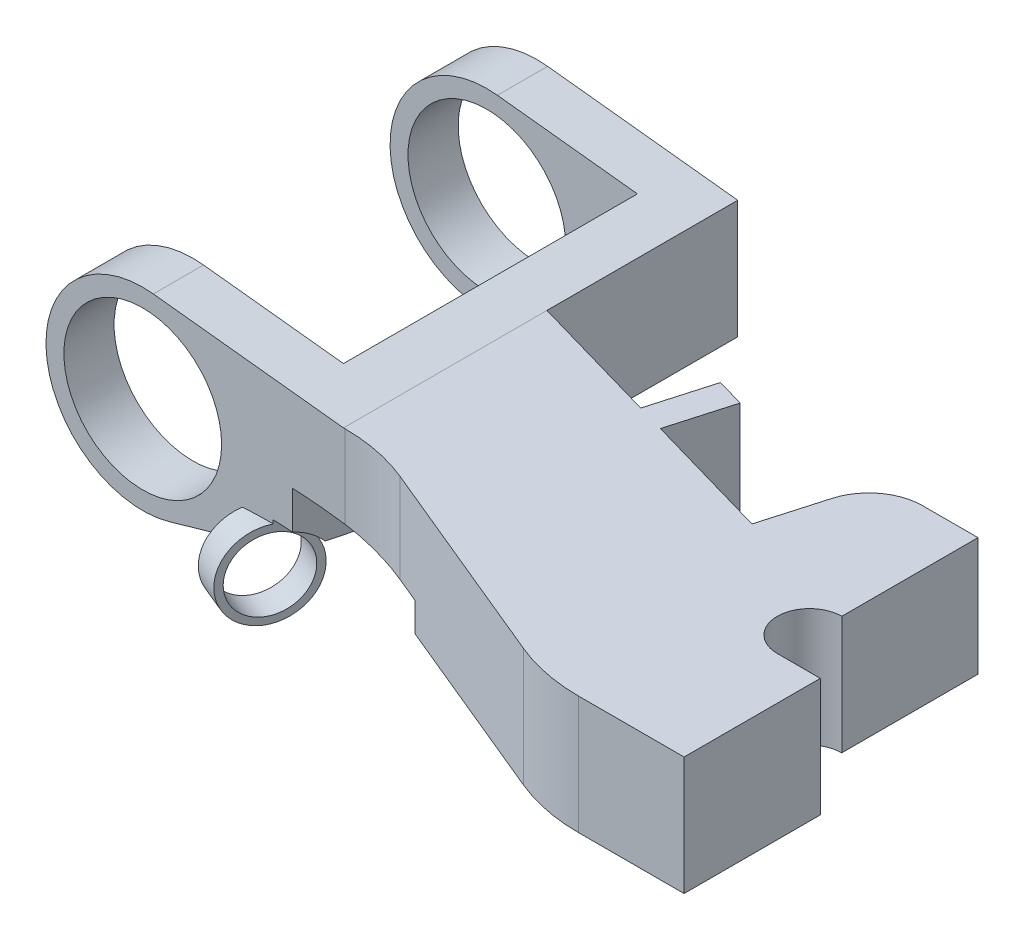
from build123d import *

# Parameters (mm, degrees)
EXTRUDE_1_DEPTH          = 13.5
CUT_EXTRUDE_1_DEPTH      = 136.073128342
CUT_EXTRUDE_1_DEPTH_BACK = 136.073128342
SKETCH_11_R              = 11
SKETCH_12_R              = 2.5
EXTRUDE_2_DEPTH          = 4.5
SKETCH_13_R              = 2.5
EXTRUDE_3_DEPTH          = 4.5
FILLET_1_R               = 25
SKETCH_15_R              = 6
SKETCH_15_R_2            = 5
EXTRUDE_4_DEPTH          = 4
CUT_EXTRUDE_START        = -4
SKETCH_19_R              = 5
CUT_EXTRUDE_3_DEPTH      = 4
CUT_EXTRUDE_START_2      = -0.5
SKETCH_20_R              = 5
CUT_EXTRUDE_4_DEPTH      = 0.5


with BuildPart() as part:
    # Эскиз10 → Бобышка-Вытянуть1 (new, symmetric)
    with BuildSketch(Plane(origin=(0, 0, 0), x_dir=(1, 0, 0), z_dir=(0, 1, 0))):
        with BuildLine():
            Line((-78, 61.5), (-92.5, 61.5))
            Line((-92.5, 61.5), (-119.5, 61.5))
            Line((-119.5, 61.5), (-119.5, 54.5))
            Line((-119.5, 54.5), (-92.5, 54.5))
            Line((-92.5, 54.5), (-85, 54.5))
            Line((-85, 54.5), (-85, 13.5))
            Line((-85, 13.5), (-92.5, 13.5))
            Line((-92.5, 13.5), (-119.5, 13.5))
            Line((-119.5, 13.5), (-119.5, 6.5))
            Line((-119.5, 6.5), (-92.5, 6.5))
            Line((-92.5, 6.5), (-72.806349184, 6.5))
            Line((-72.806349184, 6.5), (-53.492640685, -1.5))
            Line((-53.492640685, -1.5), (-34.178932186, -9.5))
            Line((-34.178932186, -9.5), (-14.48528137, -9.5))
            Line((-14.48528137, -9.5), (-14.48528137, 9.5))
            Line((-14.48528137, 9.5), (-20.48528137, 9.5))
            ThreePointArc((-20.48528137, 9.5), (-24.98528137, 14), (-20.48528137, 18.5))
            Line((-20.48528137, 18.5), (-20.48528137, 37.5))
            Line((-20.48528137, 37.5), (-28.16726189, 37.5))
            ThreePointArc((-28.16726189, 37.5), (-32.706687221, 35.981129531), (-35.41795442, 32.036211278))
            Line((-35.41795442, 32.036211278), (-37.898690622, 23.384856014))
            Line((-37.898690622, 23.384856014), (-55.820093902, 28.523735711))
            Line((-55.820093902, 28.523735711), (-53.3393577, 37.175090975))
            Line((-53.3393577, 37.175090975), (-57.184404484, 38.277640398))
            Line((-57.184404484, 38.277640398), (-59.665140686, 29.626285135))
            Line((-59.665140686, 29.626285135), (-78, 34.883721442))
            Line((-78, 34.883721442), (-78, 61.5))
        make_face()
    extrude(amount=EXTRUDE_1_DEPTH, both=True)

    # Эскиз11 → Вырез-Вытянуть1 (cut, two sides: drawn at the far end of the back side and taken through both)
    with BuildSketch(Plane.XY.offset(-CUT_EXTRUDE_1_DEPTH_BACK)):
        with BuildLine():
            Line((-11.66726189, -13.5), (-11.66726189, -6))
            Line((-11.66726189, -6), (-78, -6))
            Line((-78, -6), (-102.271403318, -12.974882149))
            ThreePointArc((-102.271403318, -12.974882149), (-104.117303664, -13.368075946), (-106, -13.5))
            Line((-106, -13.5), (-11.66726189, -13.5))
        make_face()
        with BuildLine():
            Line((-78, 10.5), (-11.66726189, 10.5))
            Line((-11.66726189, 10.5), (-11.66726189, 13.5))
            Line((-11.66726189, 13.5), (-106, 13.5))
            ThreePointArc((-106, 13.5), (-105.260484121, 13.479729829), (-104.523188999, 13.418980187))
            Line((-104.523188999, 13.418980187), (-78, 10.5))
        make_face()
        with BuildLine():
            Line((-119.5, -13.5), (-106, -13.5))
            ThreePointArc((-106, -13.5), (-115.545941546, -9.545941546), (-119.5, 0))
            Line((-119.5, 0), (-119.5, -13.5))
        make_face()
        with BuildLine():
            ThreePointArc((-119.5, 0), (-115.545941546, 9.545941546), (-106, 13.5))
            Line((-106, 13.5), (-119.5, 13.5))
            Line((-119.5, 13.5), (-119.5, 0))
        make_face()
        with Locations((-106, 0)):
            Circle(SKETCH_11_R)
    extrude(amount=CUT_EXTRUDE_1_DEPTH + CUT_EXTRUDE_1_DEPTH_BACK, mode=Mode.SUBTRACT)

    # Эскиз12 → Бобышка-Вытянуть2 (add)
    with BuildSketch(Plane(origin=(-62.981794436, 0, -18.059738941), x_dir=(-0.2756373558168036, 0, 0.961261695938375), z_dir=(-0.961261695938375, 0, -0.2756373558168036))):
        with Locations((-18.53267148, 0)):
            Circle(SKETCH_12_R)
    extrude(amount=EXTRUDE_2_DEPTH)

    # Эскиз13 → Бобышка-Вытянуть3 (add)
    with BuildSketch(Plane(origin=(-41.215344372, 0, -11.818309821), x_dir=(-0.2756373558168751, 0, 0.9612616959383545), z_dir=(-0.9612616959383545, 0, -0.2756373558168751))):
        with Locations((-18.53267148, 0)):
            Circle(SKETCH_13_R)
    extrude(amount=EXTRUDE_3_DEPTH)

    # Скругление1
    fillet_1_edges = [part.edges().sort_by_distance(p)[0] for p in [
        (-34.178932186, 2.25, 9.5),
        (-72.806349184, 2.25, -6.5),
    ]]
    fillet(fillet_1_edges, radius=FILLET_1_R)

    # Эскиз15 → Бобышка-Вытянуть4 (add)
    with BuildSketch(Plane(origin=(-80.941518, 0, -33.527074515), x_dir=(-0.38268343236509056, 0, 0.9238795325112865), z_dir=(-0.9238795325112865, 0, -0.38268343236509056))):
        with Locations((27.935890563, -12)):
            Circle(SKETCH_15_R)
        with Locations((27.935890563, -12)):
            Circle(SKETCH_15_R_2, mode=Mode.SUBTRACT)
    extrude(amount=-EXTRUDE_4_DEPTH)

    # Эскиз18 → Вырез-Повернуть2 (revolve, cut)
    with BuildSketch(Plane(origin=(-9.7155037, -16.034421878, 23.455300799), x_dir=(0.9462095031073392, -0.1825979190952245, 0.2671059268744448), z_dir=(-0.3235545954384861, -0.5339929913879853, 0.7811298924757322))):
        Polygon((-63.074879802, 2.955443363), (-69.416732567, 1.552707093), (-77.238099443, -0.177278672), (-82.761455362, -1.398973967), (-81.630628663, -6.511507649), (-84.071630178, -7.051425791), (-83.96364655, -7.539626094), (-82.667843009, -13.398029732), (-60.540265933, -8.50369426), (-61.51669247, -4.089212746), (-62.247084147, -0.787069235), align=None)
    revolve(axis=Axis((-87.936602357, -12, -6.186943272), (0.9238795325112864, 0, 0.3826834323650907)), mode=Mode.SUBTRACT)

    # Эскиз19 → Вырез-Вытянуть3 (cut)
    with BuildSketch(Plane(origin=(-77.24599987, 0, -31.996340785), x_dir=(0.3826834323650906, 0, -0.9238795325112865), z_dir=(0.9238795325112865, 0, 0.3826834323650906)).offset(CUT_EXTRUDE_START)):
        with Locations((-27.935890563, -12)):
            Circle(SKETCH_19_R)
    extrude(amount=CUT_EXTRUDE_3_DEPTH, mode=Mode.SUBTRACT)

    # Эскиз20 → Вырез-Вытянуть4 (cut)
    with BuildSketch(Plane(origin=(-80.941518, 0, -33.527074515), x_dir=(0.38268343236509067, 0, -0.9238795325112864), z_dir=(0.9238795325112864, 0, 0.38268343236509067)).offset(CUT_EXTRUDE_START_2)):
        with Locations((-27.935890563, -12)):
            Circle(SKETCH_20_R)
    extrude(amount=CUT_EXTRUDE_4_DEPTH, mode=Mode.SUBTRACT)


solid = part.part
